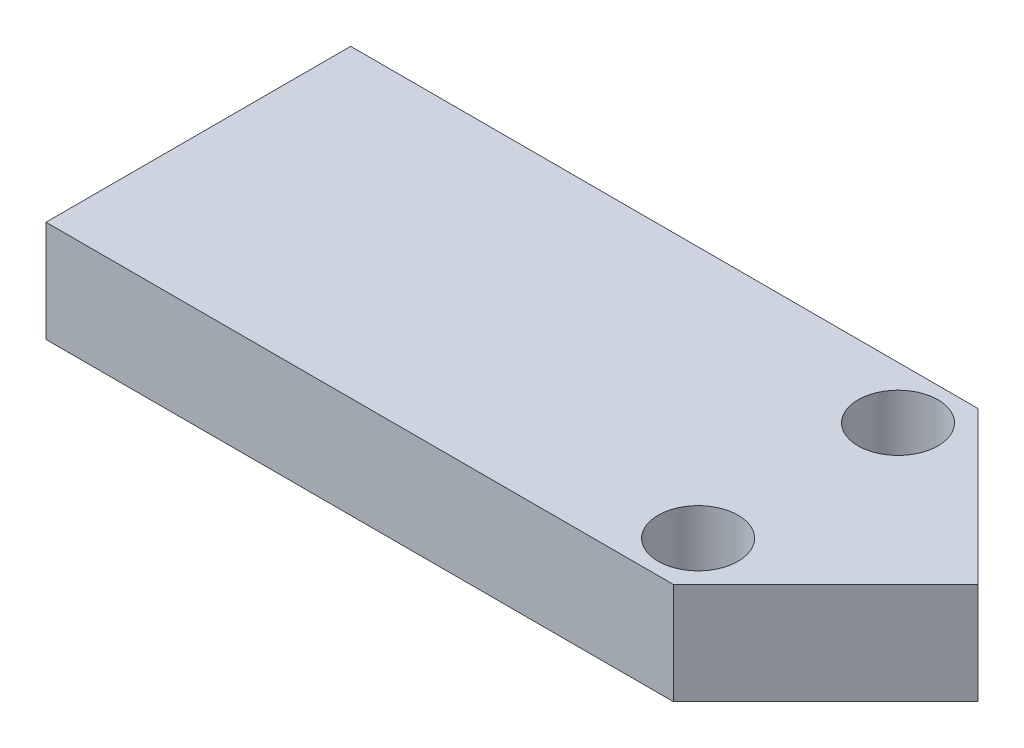
from build123d import *

# Parameters (mm, degrees)
BOSS_EXTRUDE1_DEPTH = 25.4
SKETCH2_R           = 10
CUT_EXTRUDE1_DEPTH  = 25.4


with BuildPart() as part:
    # Sketch1 → Boss-Extrude1 (new body)
    with BuildSketch(Plane(origin=(0, 0, 0), x_dir=(1, 0, 0), z_dir=(0, 1, 0))):
        Polygon((0, 76.2), (0, 0), (156.9, 0), (195, 38.1), (156.9, 76.2), align=None)
    extrude(amount=BOSS_EXTRUDE1_DEPTH)

    # Sketch2 → Cut-Extrude1 (cut)
    with BuildSketch(Plane(origin=(0, 25.4, 0), x_dir=(1, 0, 0), z_dir=(0, 1, 0))):
        with Locations((150, 63.1)):
            Circle(SKETCH2_R)
        with Locations((150, 13.1)):
            Circle(SKETCH2_R)
    extrude(amount=-CUT_EXTRUDE1_DEPTH, mode=Mode.SUBTRACT)


solid = part.part
